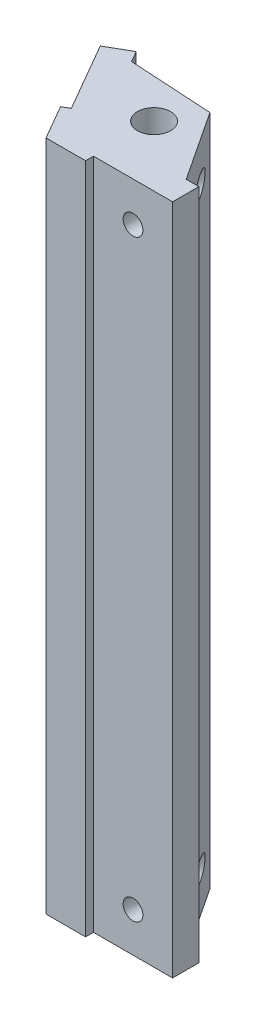
from build123d import *

# Parameters (mm, degrees)
BOSS_EXTRUDE1_DEPTH       = 85
SKETCH3_W                 = 10
SKETCH3_H                 = 1
CUT_EXTRUDE1_DEPTH        = 88.633826232
M5X0_8_TAPPED_HOLE1_D     = 4.2
M5X0_8_TAPPED_HOLE1_DEPTH = 16
M5X0_8_TAPPED_HOLE1_TIP   = 1.2618073
M5X0_8_TAPPED_HOLE2_D     = 4.2
M5X0_8_TAPPED_HOLE2_DEPTH = 16.4
M5X0_8_TAPPED_HOLE2_TIP   = 1.2618073
M3X0_5_TAPPED_HOLE1_D     = 2.5
M3X0_5_TAPPED_HOLE2_D     = 2.5


with BuildPart() as part:
    # Sketch1 → Boss-Extrude1 (new body)
    with BuildSketch(Plane(origin=(0, 0, 0), x_dir=(1, 0, 0), z_dir=(0, 1, 0))):
        Polygon((0, 0), (15, 0), (15, 4.330127019), (13.397927821, 4.330127019), (7.58741124, 13.141781765), (-2.948963911, 13.768009361), (-3.75, 15.155444566), (-7.5, 12.990381057), align=None)
    extrude(amount=BOSS_EXTRUDE1_DEPTH)

    # Sketch3 → Cut-Extrude1 (cut, through all)
    with BuildSketch(Plane(origin=(0, 85, 0), x_dir=(1, 0, 0), z_dir=(0, 1, 0))):
        Polygon((-7.5, 12.990381057), (-6.633974596, 13.490381057), (-1.633974596, 4.830127019), (-2.5, 4.330127019), align=None)
        with Locations((10, 0.5)):
            Rectangle(SKETCH3_W, SKETCH3_H)
    extrude(amount=-CUT_EXTRUDE1_DEPTH, mode=Mode.SUBTRACT)

    # M5x0.8 Tapped Hole1
    with Locations(Plane(origin=(0, 85, 0), x_dir=(1, 0, 0), z_dir=(0, 1, 0))):
        with Locations((5, 8.660254038)):
            Hole(M5X0_8_TAPPED_HOLE1_D / 2, depth=M5X0_8_TAPPED_HOLE1_DEPTH)
            with Locations((0, 0, -(M5X0_8_TAPPED_HOLE1_DEPTH + M5X0_8_TAPPED_HOLE1_TIP / 2))):  # 118° drill point
                Cone(0, M5X0_8_TAPPED_HOLE1_D / 2, M5X0_8_TAPPED_HOLE1_TIP, mode=Mode.SUBTRACT)

    # M5x0.8 Tapped Hole2
    with Locations(Plane(origin=(0, 0, 0), x_dir=(-1, 0, 0), z_dir=(0, -1, 0))):
        with Locations((-5, 8.660254038)):
            Hole(M5X0_8_TAPPED_HOLE2_D / 2, depth=M5X0_8_TAPPED_HOLE2_DEPTH)
            with Locations((0, 0, -(M5X0_8_TAPPED_HOLE2_DEPTH + M5X0_8_TAPPED_HOLE2_TIP / 2))):  # 118° drill point
                Cone(0, M5X0_8_TAPPED_HOLE2_D / 2, M5X0_8_TAPPED_HOLE2_TIP, mode=Mode.SUBTRACT)

    # M3x0.5 Tapped Hole1 (through all)
    with Locations(Plane(origin=(0.8660254037842493, 0, -0.4999999999998907), x_dir=(0.49999999999999983, 0, 0.8660254037844387), z_dir=(-0.8660254037844387, 0, 0.49999999999999983))):
        with Locations((-10, 80), (-10, 5)):
            Hole(M3X0_5_TAPPED_HOLE1_D / 2)

    # M3x0.5 Tapped Hole2 (through all)
    with Locations(Plane.XY.offset(-1)):
        with Locations((10, 80), (10, 5)):
            Hole(M3X0_5_TAPPED_HOLE2_D / 2)


solid = part.part
